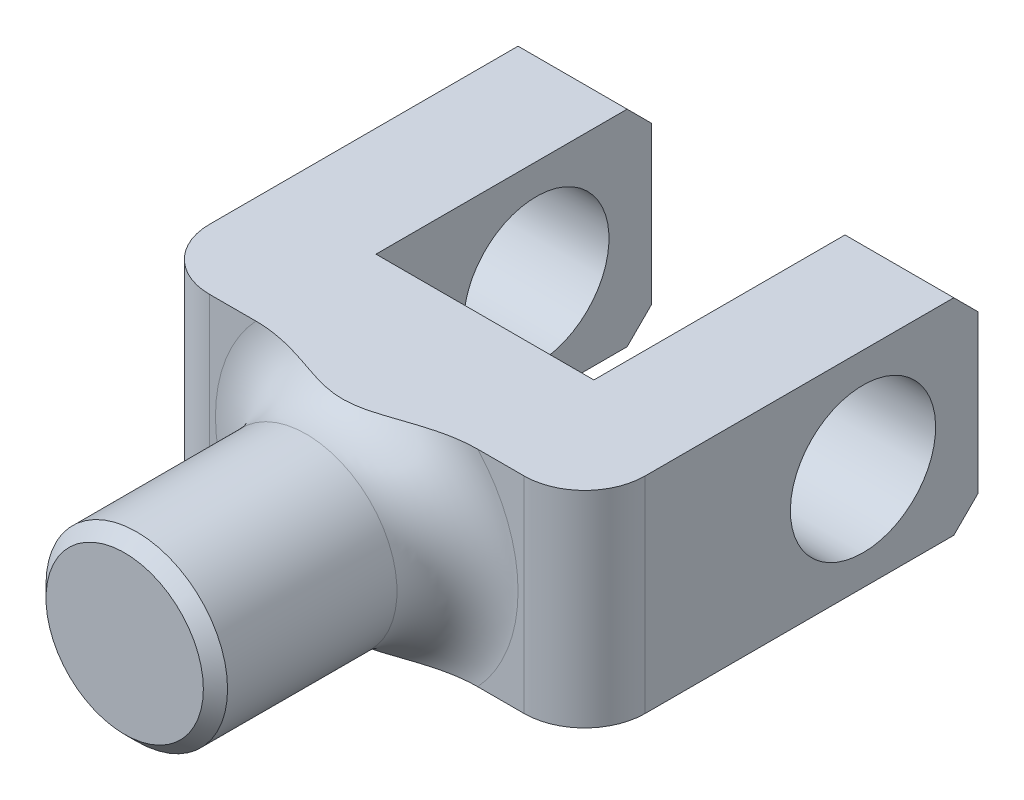
from build123d import *

# Parameters (mm, degrees)
SZKIC1_W                    = 72
SZKIC1_H                    = 34
DODANIE_WYCI_GNI_CIE1_DEPTH = 65
SZKIC3_R                    = 15
DODANIE_WYCI_GNI_CIE2_DEPTH = 40
SZKIC4_W                    = 36
SZKIC4_H                    = 34
WYTNIJ_WYCI_GNI_CIE1_DEPTH  = 45.5
SZKIC6_R                    = 12
WYTNIJ_WYCI_GNI_CIE2_DEPTH  = 73
ZAOKR_GLENIE1_R             = 10
ZAOKR_GLENIE2_R             = 10
ZAOKR_GLENIE3_R             = 10
CHAMFER4_SIZE               = 4
CHAMFER5_SIZE               = 4
CHAMFER6_SIZE               = 2


with BuildPart() as part:
    # Szkic1 → Dodanie-wyciągnięcie1 (new body)
    with BuildSketch(Plane.XY):
        with Locations((-8.770877944, 23.315845824)):
            Rectangle(SZKIC1_W, SZKIC1_H)
    extrude(amount=DODANIE_WYCI_GNI_CIE1_DEPTH)

    # Szkic3 → Dodanie-wyciągnięcie2 (add)
    with BuildSketch(Plane.XY.offset(65)):
        with Locations((-8.770877944, 23.315845824)):
            Circle(SZKIC3_R)
    extrude(amount=DODANIE_WYCI_GNI_CIE2_DEPTH)

    # Szkic4 → Wytnij-wyciągnięcie1 (cut)
    with BuildSketch(Plane(origin=(0, 0, 0), x_dir=(-1, 0, 0), z_dir=(0, 0, -1))):
        with Locations((8.744538928, 23.315845824)):
            Rectangle(SZKIC4_W, SZKIC4_H)
    extrude(amount=-WYTNIJ_WYCI_GNI_CIE1_DEPTH, mode=Mode.SUBTRACT)

    # Szkic6 → Wytnij-wyciągnięcie2 (cut)
    with BuildSketch(Plane.ZY.offset(44.770877944)):
        with Locations(Location((19, 23.315845824, 0), (0, 0, 270))):
            Circle(SZKIC6_R)
    extrude(amount=-WYTNIJ_WYCI_GNI_CIE2_DEPTH, mode=Mode.SUBTRACT)

    # Zaokrąglenie1
    # the kernel refuses this fillet: 10 mm, written as the material it adds along each edge
    with BuildSketch(Plane(origin=(-8.770877944, 23.315845824, 65), x_dir=(1, 0, 0), z_dir=(0, -1, 0))) as zaokr_glenie1_piece_1_section:
        with BuildLine():
            CenterArc((15 + ZAOKR_GLENIE1_R, ZAOKR_GLENIE1_R), ZAOKR_GLENIE1_R, 180, 90)
            Line((15, ZAOKR_GLENIE1_R), (15, 0))
            Line((15, 0), (15 + ZAOKR_GLENIE1_R, 0))
        make_face()
    zaokr_glenie1_piece_1 = revolve(axis=Axis((-8.770877944, 23.315845824, 65), (0, 0, 1)), mode=Mode.PRIVATE)
    zaokr_glenie1_piece_1 = split(zaokr_glenie1_piece_1, bisect_by=Plane(origin=(-26.605426122, 40.315845824, 67.834548177), z_dir=(0, -1, 0)), keep=Keep.TOP, mode=Mode.PRIVATE)
    zaokr_glenie1_piece_1 = split(zaokr_glenie1_piece_1, bisect_by=Plane(origin=(-26.605426122, 6.315845824, 67.834548177), z_dir=(0, 1, 0)), keep=Keep.TOP, mode=Mode.PRIVATE)
    add(zaokr_glenie1_piece_1)

    # Zaokrąglenie2
    zaokr_glenie2_edges = [part.edges().sort_by_distance(p)[0] for p in [
        (-44.770877944, 23.315845824, 65),
    ]]
    fillet(zaokr_glenie2_edges, radius=ZAOKR_GLENIE2_R)

    # Zaokrąglenie3
    zaokr_glenie3_edges = [part.edges().sort_by_distance(p)[0] for p in [
        (27.229122056, 23.315845824, 65),
    ]]
    fillet(zaokr_glenie3_edges, radius=ZAOKR_GLENIE3_R)

    # Chamfer4
    chamfer4_edges = [part.edges().sort_by_distance(p)[0] for p in [
        (18.242291564, 40.315845824, 0),
    ]]
    chamfer(chamfer4_edges, length=CHAMFER4_SIZE)

    # Chamfer5
    chamfer5_edges = [part.edges().sort_by_distance(p)[0] for p in [
        (-35.757708436, 40.315845824, 0),
        (18.242291564, 6.315845824, 0),
        (-35.757708436, 6.315845824, 0),
    ]]
    chamfer(chamfer5_edges, length=CHAMFER5_SIZE)

    # Chamfer6
    chamfer6_edges = [part.edges().sort_by_distance(p)[0] for p in [
        (-23.770877944, 23.315845824, 105),
    ]]
    chamfer(chamfer6_edges, length=CHAMFER6_SIZE)


solid = part.part
